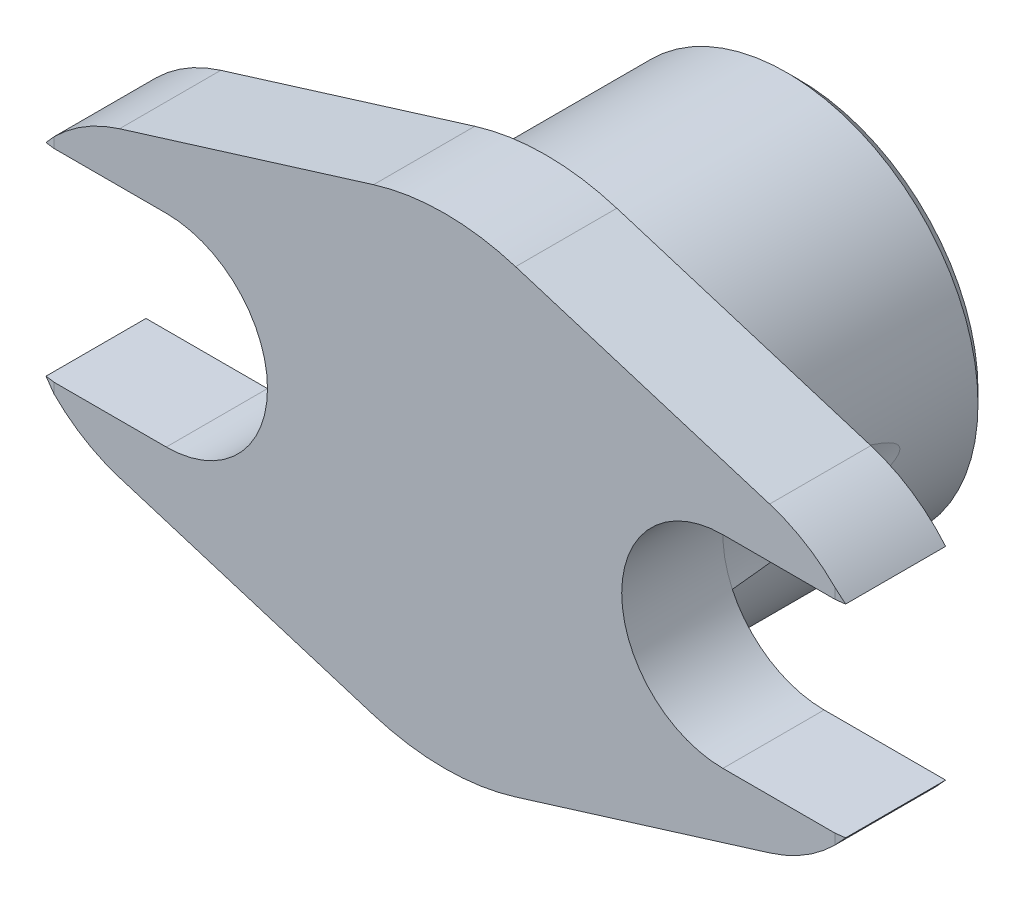
from build123d import *

# Parameters (mm, degrees)
SKETCH2_R               = 6.002734375
SKETCH2_R_2             = 3.175
EXTRUDE1_DEPTH          = 11.90625
SKETCH3_R               = 1.7859375
EXTRUDE2_DEPTH          = 3.96875
CUT_EXTRUDE2_DEPTH      = 12.7
CHAMFER1_SIZE           = 0.381
CUT_EXTRUDE3_START      = -3.818600123
CUT_EXTRUDE3_OUTLINE_R  = 1.7859375
CUT_EXTRUDE3_DEPTH      = 3.818600123
CUT_EXTRUDE4_DEPTH      = 25.4
CUT_EXTRUDE4_DEPTH_BACK = 25.4
SKETCH7_W               = 25.086219796
SKETCH7_H               = 3.328995852


with BuildPart() as part:
    # Sketch2 → Extrude1 (new body)
    with BuildSketch(Plane.XY):
        Circle(SKETCH2_R)
        Circle(SKETCH2_R_2, mode=Mode.SUBTRACT)
    extrude(amount=-EXTRUDE1_DEPTH)

    # Sketch3 → Extrude2 (add)
    with BuildSketch(Plane.XY):
        with BuildLine():
            Line((-10.196981534, -4.739465365), (-2.227911932, -7.203987355))
            ThreePointArc((-2.227911932, -7.203987355), (0, -7.540625), (2.227911932, -7.203987355))
            Line((2.227911932, -7.203987355), (10.196981534, -4.739465365))
            ThreePointArc((10.196981534, -4.739465365), (13.6921875, 0), (10.196981534, 4.739465365))
            Line((10.196981534, 4.739465365), (2.227911932, 7.203987355))
            ThreePointArc((2.227911932, 7.203987355), (0, 7.540625), (-2.227911932, 7.203987355))
            Line((-2.227911932, 7.203987355), (-10.196981534, 4.739465365))
            ThreePointArc((-10.196981534, 4.739465365), (-13.6921875, 0), (-10.196981534, -4.739465365))
        make_face()
        with Locations((8.73125, 0)):
            Circle(SKETCH3_R, mode=Mode.SUBTRACT)
        with Locations((-8.73125, 0)):
            Circle(SKETCH3_R, mode=Mode.SUBTRACT)
    extrude(amount=-EXTRUDE2_DEPTH)

    # Cut-Extrude1 cone 1 section (through the dimple's axis) → Cut-Extrude1 (revolve, cut)
    with BuildSketch(Plane(origin=(8.73125, 0, 0), x_dir=(0, -1, 0), z_dir=(1, 0, 0))):
        Polygon((0, 0), (3.571875, 0), (0, 2.997158995), align=None)
    revolve(axis=Axis((8.73125, 0, 0), (0, 0, -1)), mode=Mode.SUBTRACT)

    # Cut-Extrude1 cone 2 section (through the dimple's axis) → Cut-Extrude1 cone 2 (revolve, cut)
    with BuildSketch(Plane(origin=(-8.73125, 0, 0), x_dir=(0, -1, 0), z_dir=(1, 0, 0))):
        Polygon((0, 0), (3.571875, 0), (0, 2.997158995), align=None)
    revolve(axis=Axis((-8.73125, 0, 0), (0, 0, -1)), mode=Mode.SUBTRACT)

    # Sketch5 → Cut-Extrude2 (cut, symmetric)
    with BuildSketch(Plane(origin=(0, 0, 0), x_dir=(1, 0, 0), z_dir=(0, 1, 0))):
        with BuildLine():
            Line((13.6921875, 0.9921875), (13.6921875, -0.635))
            Line((13.6921875, -0.635), (-13.6921875, -0.635))
            Line((-13.6921875, -0.635), (-13.6921875, 0.9921875))
            ThreePointArc((-13.6921875, 0.9921875), (0, 0), (13.6921875, 0.9921875))
        make_face()
    extrude(amount=CUT_EXTRUDE2_DEPTH, both=True, mode=Mode.SUBTRACT)

    # Chamfer1
    chamfer1_edges = [part.edges().sort_by_distance(p)[0] for p in [
        (-6.002734375, 0, -11.90625),
        (-3.175, 0, -11.90625),
    ]]
    chamfer(chamfer1_edges, length=CHAMFER1_SIZE)

    # Cut-Extrude3: read off the stored shape, not the designer's step
    # Cut-Extrude3 outline → Cut-Extrude3 (cut)
    # profile 1 of 2: a face of its own
    with BuildSketch(Plane(origin=(0, 0, -3.96875), x_dir=(-1, 0, 0), z_dir=(0, 0, -1)).offset(CUT_EXTRUDE3_START)):
        with BuildLine():
            ThreePointArc((-12.543109898, 3.175), (-13.6921875, 0), (-12.543109898, -3.175))
            Line((-12.543109898, -3.175), (-8.73125, -3.175))
            ThreePointArc((-8.73125, -3.175), (-5.55625, 0), (-8.73125, 3.175))
            Line((-8.73125, 3.175), (-12.543109898, 3.175))
        make_face()
        with Locations((-8.73125, 0)):
            Circle(CUT_EXTRUDE3_OUTLINE_R, mode=Mode.SUBTRACT)
    # profile 2 of 2: a face of its own
    with BuildSketch(Plane(origin=(0, 0, -3.96875), x_dir=(-1, 0, 0), z_dir=(0, 0, -1)).offset(CUT_EXTRUDE3_START)):
        with BuildLine():
            ThreePointArc((8.73125, 3.175), (5.55625, 0), (8.73125, -3.175))
            Line((8.73125, -3.175), (12.543109898, -3.175))
            ThreePointArc((12.543109898, -3.175), (13.6921875, 0), (12.543109898, 3.175))
            Line((12.543109898, 3.175), (8.73125, 3.175))
        make_face()
        with Locations((8.73125, 0)):
            Circle(CUT_EXTRUDE3_OUTLINE_R, mode=Mode.SUBTRACT)
    extrude(amount=CUT_EXTRUDE3_DEPTH, mode=Mode.SUBTRACT)

    # Cut-Extrude3 2 outline → Cut-Extrude3 2 (revolve, cut)
    with BuildSketch(Plane(origin=(8.73125, 0, 0), x_dir=(1, 0, 0), z_dir=(0, -1, 0))):
        Polygon((2.728509965, -3.968749996), (2.728509965, -9.072154448), (3.175, -3.968749996), align=None)
    revolve(axis=Axis((8.73125, 0, 0), (0, 0, 1)), mode=Mode.SUBTRACT)

    # Cut-Extrude3 3 outline → Cut-Extrude3 3 (revolve, cut)
    with BuildSketch(Plane(origin=(-8.73125, 0, 0), x_dir=(1, 0, 0), z_dir=(0, -1, 0))):
        Polygon((2.728515625, -3.968749996), (2.728515625, -9.07208976), (3.175, -3.968749996), align=None)
    revolve(axis=Axis((-8.73125, 0, 0), (0, 0, 1)), mode=Mode.SUBTRACT)

    # Sketch7 → Cut-Extrude4 (cut, two sides: drawn at the far end of the back side and taken through both)
    with BuildSketch(Plane(origin=(0, 0, 0), x_dir=(1, 0, 0), z_dir=(0, 1, 0)).offset(-CUT_EXTRUDE4_DEPTH_BACK)):
        with Locations((0, -0.870747926)):
            Rectangle(SKETCH7_W, SKETCH7_H)
    extrude(amount=CUT_EXTRUDE4_DEPTH + CUT_EXTRUDE4_DEPTH_BACK, mode=Mode.SUBTRACT)


solid = part.part
